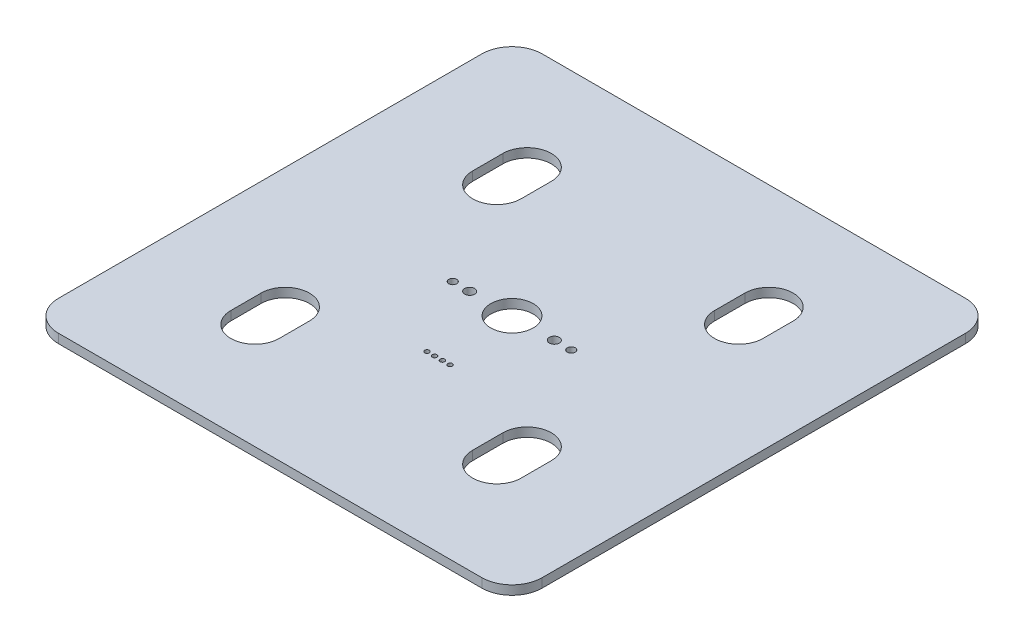
from build123d import *

# Parameters (mm, degrees)
SKETCH1_W               = 80
SKETCH1_H               = 80
BOSS_EXTRUDE1_DEPTH     = 0.75
FILLET1_R               = 5
FILLET3_R               = 5
FILLET4_R               = 5
FILLET5_R               = 5
CUT_EXTRUDE1_DEPTH      = 57.588426379
CUT_EXTRUDE1_DEPTH_BACK = 57.588426379
CUT_EXTRUDE2_DEPTH      = 57.588426379
CUT_EXTRUDE2_DEPTH_BACK = 57.588426379
SKETCH3_R               = 3.5
CUT_EXTRUDE3_DEPTH      = 57.588426379
CUT_EXTRUDE3_DEPTH_BACK = 57.588426379
SKETCH4_R               = 0.38
SKETCH4_R_2             = 0.65
SKETCH4_R_3             = 0.825


with BuildPart() as part:
    # Sketch1 → Boss-Extrude1 (new, symmetric)
    with BuildSketch(Plane(origin=(0, 0, 0), x_dir=(1, 0, 0), z_dir=(0, 1, 0))):
        Rectangle(SKETCH1_W, SKETCH1_H)
    extrude(amount=BOSS_EXTRUDE1_DEPTH, both=True)

    # Fillet1
    fillet1_edges = [part.edges().sort_by_distance(p)[0] for p in [
        (-40, 0, 40),
    ]]
    fillet(fillet1_edges, radius=FILLET1_R)

    # Fillet3
    fillet3_edges = [part.edges().sort_by_distance(p)[0] for p in [
        (-40, 0, -40),
    ]]
    fillet(fillet3_edges, radius=FILLET3_R)

    # Fillet4
    fillet4_edges = [part.edges().sort_by_distance(p)[0] for p in [
        (40, 0, -40),
    ]]
    fillet(fillet4_edges, radius=FILLET4_R)

    # Fillet5
    fillet5_edges = [part.edges().sort_by_distance(p)[0] for p in [
        (40, 0, 40),
    ]]
    fillet(fillet5_edges, radius=FILLET5_R)

    # Sketch2 → Cut-Extrude1 (cut, two sides: drawn at the far end of the back side and taken through both)
    with BuildSketch(Plane(origin=(0, 0.75, 0), x_dir=(1, 0, 0), z_dir=(0, 1, 0)).offset(-CUT_EXTRUDE1_DEPTH_BACK)):
        with BuildLine():
            Line((-24, 17.5), (-24, 22.5))
            ThreePointArc((-24, 22.5), (-20, 26.5), (-16, 22.5))
            Line((-16, 22.5), (-16, 17.5))
            ThreePointArc((-16, 17.5), (-20, 13.5), (-24, 17.5))
        make_face()
        with BuildLine():
            Line((-16, -17.5), (-16, -22.5))
            ThreePointArc((-16, -22.5), (-20, -26.5), (-24, -22.5))
            Line((-24, -22.5), (-24, -17.5))
            ThreePointArc((-24, -17.5), (-20, -13.5), (-16, -17.5))
        make_face()
        with BuildLine():
            Line((16, -17.5), (16, -22.5))
            ThreePointArc((16, -22.5), (20, -26.5), (24, -22.5))
            Line((24, -22.5), (24, -17.5))
            ThreePointArc((24, -17.5), (20, -13.5), (16, -17.5))
        make_face()
        with BuildLine():
            Line((24, 17.5), (24, 22.5))
            ThreePointArc((24, 22.5), (20, 26.5), (16, 22.5))
            Line((16, 22.5), (16, 17.5))
            ThreePointArc((16, 17.5), (20, 13.5), (24, 17.5))
        make_face()
    extrude(amount=CUT_EXTRUDE1_DEPTH + CUT_EXTRUDE1_DEPTH_BACK, mode=Mode.SUBTRACT)

    # Sketch3 → Cut-Extrude2 (cut, two sides: drawn at the far end of the back side and taken through both)
    with BuildSketch(Plane(origin=(0, 0.75, 0), x_dir=(1, 0, 0), z_dir=(0, 1, 0)).offset(-CUT_EXTRUDE2_DEPTH_BACK)):
        Circle(SKETCH3_R)
    extrude(amount=CUT_EXTRUDE2_DEPTH + CUT_EXTRUDE2_DEPTH_BACK, mode=Mode.SUBTRACT)

    # Sketch4 → Cut-Extrude3 (cut, two sides: drawn at the far end of the back side and taken through both)
    with BuildSketch(Plane(origin=(0, 0.75, 0), x_dir=(1, 0, 0), z_dir=(0, 1, 0)).offset(-CUT_EXTRUDE3_DEPTH_BACK)):
        with Locations((-0.635, -12.15)):
            Circle(SKETCH4_R)
        with Locations((-1.905, -12.15)):
            Circle(SKETCH4_R)
        with Locations((-9.8, 0)):
            Circle(SKETCH4_R_2)
        with Locations((-7, 0)):
            Circle(SKETCH4_R_3)
        with Locations((7, 0)):
            Circle(SKETCH4_R_3)
        with Locations((9.8, 0)):
            Circle(SKETCH4_R_2)
        with Locations((0.635, -12.15)):
            Circle(SKETCH4_R)
        with Locations((1.905, -12.15)):
            Circle(SKETCH4_R)
    extrude(amount=CUT_EXTRUDE3_DEPTH + CUT_EXTRUDE3_DEPTH_BACK, mode=Mode.SUBTRACT)


solid = part.part
